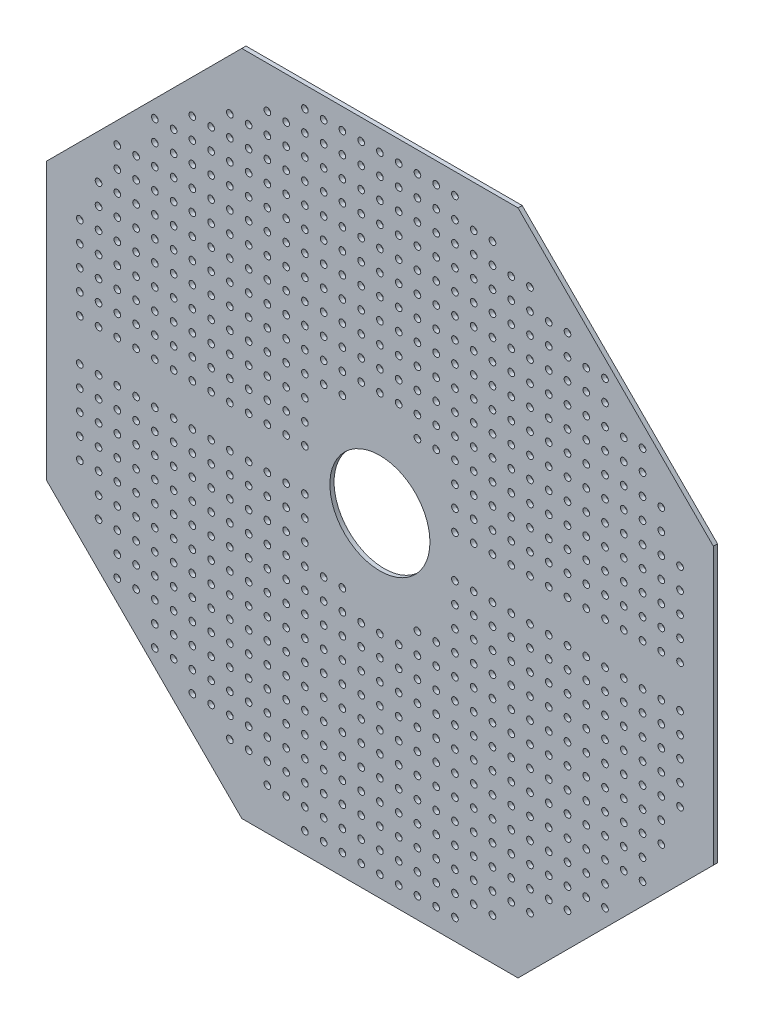
from build123d import *

# Parameters (mm, degrees)
SKETCH_1_R      = 120
SKETCH_1_R_2    = 8
EXTRUDE_1_DEPTH = 10


with BuildPart() as part:
    # 草图1 → 凸台-拉伸1 (new body)
    with BuildSketch(Plane.XY):
        Polygon((331.370849898, 800), (-331.370849898, 800), (-800, 331.370849898), (-800, -331.370849898), (-331.370849898, -800), (331.370849898, -800), (800, -331.370849898), (800, 331.370849898), align=None)
        Circle(SKETCH_1_R, mode=Mode.SUBTRACT)
        with Locations((180, 50)):
            Circle(SKETCH_1_R_2, mode=Mode.SUBTRACT)
        with Locations((225, 50)):
            Circle(SKETCH_1_R_2, mode=Mode.SUBTRACT)
        with Locations((270, 50)):
            Circle(SKETCH_1_R_2, mode=Mode.SUBTRACT)
        with Locations((315, 50)):
            Circle(SKETCH_1_R_2, mode=Mode.SUBTRACT)
        with Locations((360, 50)):
            Circle(SKETCH_1_R_2, mode=Mode.SUBTRACT)
        with Locations((405, 50)):
            Circle(SKETCH_1_R_2, mode=Mode.SUBTRACT)
        with Locations((450, 50)):
            Circle(SKETCH_1_R_2, mode=Mode.SUBTRACT)
        with Locations((495, 50)):
            Circle(SKETCH_1_R_2, mode=Mode.SUBTRACT)
        with Locations((540, 50)):
            Circle(SKETCH_1_R_2, mode=Mode.SUBTRACT)
        with Locations((585, 50)):
            Circle(SKETCH_1_R_2, mode=Mode.SUBTRACT)
        with Locations((630, 50)):
            Circle(SKETCH_1_R_2, mode=Mode.SUBTRACT)
        with Locations((675, 50)):
            Circle(SKETCH_1_R_2, mode=Mode.SUBTRACT)
        with Locations((720, 50)):
            Circle(SKETCH_1_R_2, mode=Mode.SUBTRACT)
        with Locations((180, 100)):
            Circle(SKETCH_1_R_2, mode=Mode.SUBTRACT)
        with Locations((225, 100)):
            Circle(SKETCH_1_R_2, mode=Mode.SUBTRACT)
        with Locations((270, 100)):
            Circle(SKETCH_1_R_2, mode=Mode.SUBTRACT)
        with Locations((315, 100)):
            Circle(SKETCH_1_R_2, mode=Mode.SUBTRACT)
        with Locations((360, 100)):
            Circle(SKETCH_1_R_2, mode=Mode.SUBTRACT)
        with Locations((405, 100)):
            Circle(SKETCH_1_R_2, mode=Mode.SUBTRACT)
        with Locations((450, 100)):
            Circle(SKETCH_1_R_2, mode=Mode.SUBTRACT)
        with Locations((495, 100)):
            Circle(SKETCH_1_R_2, mode=Mode.SUBTRACT)
        with Locations((540, 100)):
            Circle(SKETCH_1_R_2, mode=Mode.SUBTRACT)
        with Locations((585, 100)):
            Circle(SKETCH_1_R_2, mode=Mode.SUBTRACT)
        with Locations((630, 100)):
            Circle(SKETCH_1_R_2, mode=Mode.SUBTRACT)
        with Locations((675, 100)):
            Circle(SKETCH_1_R_2, mode=Mode.SUBTRACT)
        with Locations((720, 100)):
            Circle(SKETCH_1_R_2, mode=Mode.SUBTRACT)
        with Locations((180, 150)):
            Circle(SKETCH_1_R_2, mode=Mode.SUBTRACT)
        with Locations((225, 150)):
            Circle(SKETCH_1_R_2, mode=Mode.SUBTRACT)
        with Locations((270, 150)):
            Circle(SKETCH_1_R_2, mode=Mode.SUBTRACT)
        with Locations((315, 150)):
            Circle(SKETCH_1_R_2, mode=Mode.SUBTRACT)
        with Locations((360, 150)):
            Circle(SKETCH_1_R_2, mode=Mode.SUBTRACT)
        with Locations((405, 150)):
            Circle(SKETCH_1_R_2, mode=Mode.SUBTRACT)
        with Locations((450, 150)):
            Circle(SKETCH_1_R_2, mode=Mode.SUBTRACT)
        with Locations((495, 150)):
            Circle(SKETCH_1_R_2, mode=Mode.SUBTRACT)
        with Locations((540, 150)):
            Circle(SKETCH_1_R_2, mode=Mode.SUBTRACT)
        with Locations((585, 150)):
            Circle(SKETCH_1_R_2, mode=Mode.SUBTRACT)
        with Locations((630, 150)):
            Circle(SKETCH_1_R_2, mode=Mode.SUBTRACT)
        with Locations((675, 150)):
            Circle(SKETCH_1_R_2, mode=Mode.SUBTRACT)
        with Locations((720, 150)):
            Circle(SKETCH_1_R_2, mode=Mode.SUBTRACT)
        with Locations((90, 200)):
            Circle(SKETCH_1_R_2, mode=Mode.SUBTRACT)
        with Locations((135, 200)):
            Circle(SKETCH_1_R_2, mode=Mode.SUBTRACT)
        with Locations((180, 200)):
            Circle(SKETCH_1_R_2, mode=Mode.SUBTRACT)
        with Locations((225, 200)):
            Circle(SKETCH_1_R_2, mode=Mode.SUBTRACT)
        with Locations((270, 200)):
            Circle(SKETCH_1_R_2, mode=Mode.SUBTRACT)
        with Locations((315, 200)):
            Circle(SKETCH_1_R_2, mode=Mode.SUBTRACT)
        with Locations((360, 200)):
            Circle(SKETCH_1_R_2, mode=Mode.SUBTRACT)
        with Locations((405, 200)):
            Circle(SKETCH_1_R_2, mode=Mode.SUBTRACT)
        with Locations((450, 200)):
            Circle(SKETCH_1_R_2, mode=Mode.SUBTRACT)
        with Locations((495, 200)):
            Circle(SKETCH_1_R_2, mode=Mode.SUBTRACT)
        with Locations((540, 200)):
            Circle(SKETCH_1_R_2, mode=Mode.SUBTRACT)
        with Locations((585, 200)):
            Circle(SKETCH_1_R_2, mode=Mode.SUBTRACT)
        with Locations((630, 200)):
            Circle(SKETCH_1_R_2, mode=Mode.SUBTRACT)
        with Locations((675, 200)):
            Circle(SKETCH_1_R_2, mode=Mode.SUBTRACT)
        with Locations((720, 200)):
            Circle(SKETCH_1_R_2, mode=Mode.SUBTRACT)
        with Locations((0, 250)):
            Circle(SKETCH_1_R_2, mode=Mode.SUBTRACT)
        with Locations((45, 250)):
            Circle(SKETCH_1_R_2, mode=Mode.SUBTRACT)
        with Locations((90, 250)):
            Circle(SKETCH_1_R_2, mode=Mode.SUBTRACT)
        with Locations((135, 250)):
            Circle(SKETCH_1_R_2, mode=Mode.SUBTRACT)
        with Locations((180, 250)):
            Circle(SKETCH_1_R_2, mode=Mode.SUBTRACT)
        with Locations((225, 250)):
            Circle(SKETCH_1_R_2, mode=Mode.SUBTRACT)
        with Locations((270, 250)):
            Circle(SKETCH_1_R_2, mode=Mode.SUBTRACT)
        with Locations((315, 250)):
            Circle(SKETCH_1_R_2, mode=Mode.SUBTRACT)
        with Locations((360, 250)):
            Circle(SKETCH_1_R_2, mode=Mode.SUBTRACT)
        with Locations((405, 250)):
            Circle(SKETCH_1_R_2, mode=Mode.SUBTRACT)
        with Locations((450, 250)):
            Circle(SKETCH_1_R_2, mode=Mode.SUBTRACT)
        with Locations((495, 250)):
            Circle(SKETCH_1_R_2, mode=Mode.SUBTRACT)
        with Locations((540, 250)):
            Circle(SKETCH_1_R_2, mode=Mode.SUBTRACT)
        with Locations((585, 250)):
            Circle(SKETCH_1_R_2, mode=Mode.SUBTRACT)
        with Locations((630, 250)):
            Circle(SKETCH_1_R_2, mode=Mode.SUBTRACT)
        with Locations((675, 250)):
            Circle(SKETCH_1_R_2, mode=Mode.SUBTRACT)
        with Locations((720, 250)):
            Circle(SKETCH_1_R_2, mode=Mode.SUBTRACT)
        with Locations((0, 300)):
            Circle(SKETCH_1_R_2, mode=Mode.SUBTRACT)
        with Locations((45, 300)):
            Circle(SKETCH_1_R_2, mode=Mode.SUBTRACT)
        with Locations((90, 300)):
            Circle(SKETCH_1_R_2, mode=Mode.SUBTRACT)
        with Locations((135, 300)):
            Circle(SKETCH_1_R_2, mode=Mode.SUBTRACT)
        with Locations((180, 300)):
            Circle(SKETCH_1_R_2, mode=Mode.SUBTRACT)
        with Locations((225, 300)):
            Circle(SKETCH_1_R_2, mode=Mode.SUBTRACT)
        with Locations((270, 300)):
            Circle(SKETCH_1_R_2, mode=Mode.SUBTRACT)
        with Locations((315, 300)):
            Circle(SKETCH_1_R_2, mode=Mode.SUBTRACT)
        with Locations((360, 300)):
            Circle(SKETCH_1_R_2, mode=Mode.SUBTRACT)
        with Locations((405, 300)):
            Circle(SKETCH_1_R_2, mode=Mode.SUBTRACT)
        with Locations((450, 300)):
            Circle(SKETCH_1_R_2, mode=Mode.SUBTRACT)
        with Locations((495, 300)):
            Circle(SKETCH_1_R_2, mode=Mode.SUBTRACT)
        with Locations((540, 300)):
            Circle(SKETCH_1_R_2, mode=Mode.SUBTRACT)
        with Locations((585, 300)):
            Circle(SKETCH_1_R_2, mode=Mode.SUBTRACT)
        with Locations((630, 300)):
            Circle(SKETCH_1_R_2, mode=Mode.SUBTRACT)
        with Locations((675, 300)):
            Circle(SKETCH_1_R_2, mode=Mode.SUBTRACT)
        with Locations((0, 350)):
            Circle(SKETCH_1_R_2, mode=Mode.SUBTRACT)
        with Locations((45, 350)):
            Circle(SKETCH_1_R_2, mode=Mode.SUBTRACT)
        with Locations((90, 350)):
            Circle(SKETCH_1_R_2, mode=Mode.SUBTRACT)
        with Locations((135, 350)):
            Circle(SKETCH_1_R_2, mode=Mode.SUBTRACT)
        with Locations((180, 350)):
            Circle(SKETCH_1_R_2, mode=Mode.SUBTRACT)
        with Locations((225, 350)):
            Circle(SKETCH_1_R_2, mode=Mode.SUBTRACT)
        with Locations((270, 350)):
            Circle(SKETCH_1_R_2, mode=Mode.SUBTRACT)
        with Locations((315, 350)):
            Circle(SKETCH_1_R_2, mode=Mode.SUBTRACT)
        with Locations((360, 350)):
            Circle(SKETCH_1_R_2, mode=Mode.SUBTRACT)
        with Locations((405, 350)):
            Circle(SKETCH_1_R_2, mode=Mode.SUBTRACT)
        with Locations((450, 350)):
            Circle(SKETCH_1_R_2, mode=Mode.SUBTRACT)
        with Locations((495, 350)):
            Circle(SKETCH_1_R_2, mode=Mode.SUBTRACT)
        with Locations((540, 350)):
            Circle(SKETCH_1_R_2, mode=Mode.SUBTRACT)
        with Locations((585, 350)):
            Circle(SKETCH_1_R_2, mode=Mode.SUBTRACT)
        with Locations((630, 350)):
            Circle(SKETCH_1_R_2, mode=Mode.SUBTRACT)
        with Locations((675, 350)):
            Circle(SKETCH_1_R_2, mode=Mode.SUBTRACT)
        with Locations((0, 400)):
            Circle(SKETCH_1_R_2, mode=Mode.SUBTRACT)
        with Locations((45, 400)):
            Circle(SKETCH_1_R_2, mode=Mode.SUBTRACT)
        with Locations((90, 400)):
            Circle(SKETCH_1_R_2, mode=Mode.SUBTRACT)
        with Locations((135, 400)):
            Circle(SKETCH_1_R_2, mode=Mode.SUBTRACT)
        with Locations((180, 400)):
            Circle(SKETCH_1_R_2, mode=Mode.SUBTRACT)
        with Locations((225, 400)):
            Circle(SKETCH_1_R_2, mode=Mode.SUBTRACT)
        with Locations((270, 400)):
            Circle(SKETCH_1_R_2, mode=Mode.SUBTRACT)
        with Locations((315, 400)):
            Circle(SKETCH_1_R_2, mode=Mode.SUBTRACT)
        with Locations((360, 400)):
            Circle(SKETCH_1_R_2, mode=Mode.SUBTRACT)
        with Locations((405, 400)):
            Circle(SKETCH_1_R_2, mode=Mode.SUBTRACT)
        with Locations((450, 400)):
            Circle(SKETCH_1_R_2, mode=Mode.SUBTRACT)
        with Locations((495, 400)):
            Circle(SKETCH_1_R_2, mode=Mode.SUBTRACT)
        with Locations((540, 400)):
            Circle(SKETCH_1_R_2, mode=Mode.SUBTRACT)
        with Locations((585, 400)):
            Circle(SKETCH_1_R_2, mode=Mode.SUBTRACT)
        with Locations((630, 400)):
            Circle(SKETCH_1_R_2, mode=Mode.SUBTRACT)
        with Locations((0, 450)):
            Circle(SKETCH_1_R_2, mode=Mode.SUBTRACT)
        with Locations((45, 450)):
            Circle(SKETCH_1_R_2, mode=Mode.SUBTRACT)
        with Locations((90, 450)):
            Circle(SKETCH_1_R_2, mode=Mode.SUBTRACT)
        with Locations((135, 450)):
            Circle(SKETCH_1_R_2, mode=Mode.SUBTRACT)
        with Locations((180, 450)):
            Circle(SKETCH_1_R_2, mode=Mode.SUBTRACT)
        with Locations((225, 450)):
            Circle(SKETCH_1_R_2, mode=Mode.SUBTRACT)
        with Locations((270, 450)):
            Circle(SKETCH_1_R_2, mode=Mode.SUBTRACT)
        with Locations((315, 450)):
            Circle(SKETCH_1_R_2, mode=Mode.SUBTRACT)
        with Locations((360, 450)):
            Circle(SKETCH_1_R_2, mode=Mode.SUBTRACT)
        with Locations((405, 450)):
            Circle(SKETCH_1_R_2, mode=Mode.SUBTRACT)
        with Locations((450, 450)):
            Circle(SKETCH_1_R_2, mode=Mode.SUBTRACT)
        with Locations((495, 450)):
            Circle(SKETCH_1_R_2, mode=Mode.SUBTRACT)
        with Locations((540, 450)):
            Circle(SKETCH_1_R_2, mode=Mode.SUBTRACT)
        with Locations((585, 450)):
            Circle(SKETCH_1_R_2, mode=Mode.SUBTRACT)
        with Locations((630, 450)):
            Circle(SKETCH_1_R_2, mode=Mode.SUBTRACT)
        with Locations((0, 500)):
            Circle(SKETCH_1_R_2, mode=Mode.SUBTRACT)
        with Locations((45, 500)):
            Circle(SKETCH_1_R_2, mode=Mode.SUBTRACT)
        with Locations((90, 500)):
            Circle(SKETCH_1_R_2, mode=Mode.SUBTRACT)
        with Locations((135, 500)):
            Circle(SKETCH_1_R_2, mode=Mode.SUBTRACT)
        with Locations((180, 500)):
            Circle(SKETCH_1_R_2, mode=Mode.SUBTRACT)
        with Locations((225, 500)):
            Circle(SKETCH_1_R_2, mode=Mode.SUBTRACT)
        with Locations((270, 500)):
            Circle(SKETCH_1_R_2, mode=Mode.SUBTRACT)
        with Locations((315, 500)):
            Circle(SKETCH_1_R_2, mode=Mode.SUBTRACT)
        with Locations((360, 500)):
            Circle(SKETCH_1_R_2, mode=Mode.SUBTRACT)
        with Locations((405, 500)):
            Circle(SKETCH_1_R_2, mode=Mode.SUBTRACT)
        with Locations((450, 500)):
            Circle(SKETCH_1_R_2, mode=Mode.SUBTRACT)
        with Locations((495, 500)):
            Circle(SKETCH_1_R_2, mode=Mode.SUBTRACT)
        with Locations((540, 500)):
            Circle(SKETCH_1_R_2, mode=Mode.SUBTRACT)
        with Locations((0, 550)):
            Circle(SKETCH_1_R_2, mode=Mode.SUBTRACT)
        with Locations((45, 550)):
            Circle(SKETCH_1_R_2, mode=Mode.SUBTRACT)
        with Locations((90, 550)):
            Circle(SKETCH_1_R_2, mode=Mode.SUBTRACT)
        with Locations((135, 550)):
            Circle(SKETCH_1_R_2, mode=Mode.SUBTRACT)
        with Locations((180, 550)):
            Circle(SKETCH_1_R_2, mode=Mode.SUBTRACT)
        with Locations((225, 550)):
            Circle(SKETCH_1_R_2, mode=Mode.SUBTRACT)
        with Locations((270, 550)):
            Circle(SKETCH_1_R_2, mode=Mode.SUBTRACT)
        with Locations((315, 550)):
            Circle(SKETCH_1_R_2, mode=Mode.SUBTRACT)
        with Locations((360, 550)):
            Circle(SKETCH_1_R_2, mode=Mode.SUBTRACT)
        with Locations((405, 550)):
            Circle(SKETCH_1_R_2, mode=Mode.SUBTRACT)
        with Locations((450, 550)):
            Circle(SKETCH_1_R_2, mode=Mode.SUBTRACT)
        with Locations((495, 550)):
            Circle(SKETCH_1_R_2, mode=Mode.SUBTRACT)
        with Locations((540, 550)):
            Circle(SKETCH_1_R_2, mode=Mode.SUBTRACT)
        with Locations((0, 600)):
            Circle(SKETCH_1_R_2, mode=Mode.SUBTRACT)
        with Locations((45, 600)):
            Circle(SKETCH_1_R_2, mode=Mode.SUBTRACT)
        with Locations((90, 600)):
            Circle(SKETCH_1_R_2, mode=Mode.SUBTRACT)
        with Locations((135, 600)):
            Circle(SKETCH_1_R_2, mode=Mode.SUBTRACT)
        with Locations((180, 600)):
            Circle(SKETCH_1_R_2, mode=Mode.SUBTRACT)
        with Locations((225, 600)):
            Circle(SKETCH_1_R_2, mode=Mode.SUBTRACT)
        with Locations((270, 600)):
            Circle(SKETCH_1_R_2, mode=Mode.SUBTRACT)
        with Locations((315, 600)):
            Circle(SKETCH_1_R_2, mode=Mode.SUBTRACT)
        with Locations((360, 600)):
            Circle(SKETCH_1_R_2, mode=Mode.SUBTRACT)
        with Locations((405, 600)):
            Circle(SKETCH_1_R_2, mode=Mode.SUBTRACT)
        with Locations((450, 600)):
            Circle(SKETCH_1_R_2, mode=Mode.SUBTRACT)
        with Locations((0, 650)):
            Circle(SKETCH_1_R_2, mode=Mode.SUBTRACT)
        with Locations((45, 650)):
            Circle(SKETCH_1_R_2, mode=Mode.SUBTRACT)
        with Locations((90, 650)):
            Circle(SKETCH_1_R_2, mode=Mode.SUBTRACT)
        with Locations((135, 650)):
            Circle(SKETCH_1_R_2, mode=Mode.SUBTRACT)
        with Locations((180, 650)):
            Circle(SKETCH_1_R_2, mode=Mode.SUBTRACT)
        with Locations((225, 650)):
            Circle(SKETCH_1_R_2, mode=Mode.SUBTRACT)
        with Locations((270, 650)):
            Circle(SKETCH_1_R_2, mode=Mode.SUBTRACT)
        with Locations((315, 650)):
            Circle(SKETCH_1_R_2, mode=Mode.SUBTRACT)
        with Locations((360, 650)):
            Circle(SKETCH_1_R_2, mode=Mode.SUBTRACT)
        with Locations((0, 700)):
            Circle(SKETCH_1_R_2, mode=Mode.SUBTRACT)
        with Locations((45, 700)):
            Circle(SKETCH_1_R_2, mode=Mode.SUBTRACT)
        with Locations((90, 700)):
            Circle(SKETCH_1_R_2, mode=Mode.SUBTRACT)
        with Locations((135, 700)):
            Circle(SKETCH_1_R_2, mode=Mode.SUBTRACT)
        with Locations((180, 700)):
            Circle(SKETCH_1_R_2, mode=Mode.SUBTRACT)
        with Locations((225, 700)):
            Circle(SKETCH_1_R_2, mode=Mode.SUBTRACT)
        with Locations((270, 700)):
            Circle(SKETCH_1_R_2, mode=Mode.SUBTRACT)
        with Locations((0, 750)):
            Circle(SKETCH_1_R_2, mode=Mode.SUBTRACT)
        with Locations((45, 750)):
            Circle(SKETCH_1_R_2, mode=Mode.SUBTRACT)
        with Locations((90, 750)):
            Circle(SKETCH_1_R_2, mode=Mode.SUBTRACT)
        with Locations((135, 750)):
            Circle(SKETCH_1_R_2, mode=Mode.SUBTRACT)
        with Locations((180, 750)):
            Circle(SKETCH_1_R_2, mode=Mode.SUBTRACT)
        with Locations((-180, 750)):
            Circle(SKETCH_1_R_2, mode=Mode.SUBTRACT)
        with Locations((-135, 750)):
            Circle(SKETCH_1_R_2, mode=Mode.SUBTRACT)
        with Locations((-90, 750)):
            Circle(SKETCH_1_R_2, mode=Mode.SUBTRACT)
        with Locations((-45, 750)):
            Circle(SKETCH_1_R_2, mode=Mode.SUBTRACT)
        with Locations((-270, 700)):
            Circle(SKETCH_1_R_2, mode=Mode.SUBTRACT)
        with Locations((-225, 700)):
            Circle(SKETCH_1_R_2, mode=Mode.SUBTRACT)
        with Locations((-180, 700)):
            Circle(SKETCH_1_R_2, mode=Mode.SUBTRACT)
        with Locations((-135, 700)):
            Circle(SKETCH_1_R_2, mode=Mode.SUBTRACT)
        with Locations((-90, 700)):
            Circle(SKETCH_1_R_2, mode=Mode.SUBTRACT)
        with Locations((-45, 700)):
            Circle(SKETCH_1_R_2, mode=Mode.SUBTRACT)
        with Locations((-360, 650)):
            Circle(SKETCH_1_R_2, mode=Mode.SUBTRACT)
        with Locations((-315, 650)):
            Circle(SKETCH_1_R_2, mode=Mode.SUBTRACT)
        with Locations((-270, 650)):
            Circle(SKETCH_1_R_2, mode=Mode.SUBTRACT)
        with Locations((-225, 650)):
            Circle(SKETCH_1_R_2, mode=Mode.SUBTRACT)
        with Locations((-180, 650)):
            Circle(SKETCH_1_R_2, mode=Mode.SUBTRACT)
        with Locations((-135, 650)):
            Circle(SKETCH_1_R_2, mode=Mode.SUBTRACT)
        with Locations((-90, 650)):
            Circle(SKETCH_1_R_2, mode=Mode.SUBTRACT)
        with Locations((-45, 650)):
            Circle(SKETCH_1_R_2, mode=Mode.SUBTRACT)
        with Locations((-450, 600)):
            Circle(SKETCH_1_R_2, mode=Mode.SUBTRACT)
        with Locations((-405, 600)):
            Circle(SKETCH_1_R_2, mode=Mode.SUBTRACT)
        with Locations((-360, 600)):
            Circle(SKETCH_1_R_2, mode=Mode.SUBTRACT)
        with Locations((-315, 600)):
            Circle(SKETCH_1_R_2, mode=Mode.SUBTRACT)
        with Locations((-270, 600)):
            Circle(SKETCH_1_R_2, mode=Mode.SUBTRACT)
        with Locations((-225, 600)):
            Circle(SKETCH_1_R_2, mode=Mode.SUBTRACT)
        with Locations((-180, 600)):
            Circle(SKETCH_1_R_2, mode=Mode.SUBTRACT)
        with Locations((-135, 600)):
            Circle(SKETCH_1_R_2, mode=Mode.SUBTRACT)
        with Locations((-90, 600)):
            Circle(SKETCH_1_R_2, mode=Mode.SUBTRACT)
        with Locations((-45, 600)):
            Circle(SKETCH_1_R_2, mode=Mode.SUBTRACT)
        with Locations((-540, 550)):
            Circle(SKETCH_1_R_2, mode=Mode.SUBTRACT)
        with Locations((-495, 550)):
            Circle(SKETCH_1_R_2, mode=Mode.SUBTRACT)
        with Locations((-450, 550)):
            Circle(SKETCH_1_R_2, mode=Mode.SUBTRACT)
        with Locations((-405, 550)):
            Circle(SKETCH_1_R_2, mode=Mode.SUBTRACT)
        with Locations((-360, 550)):
            Circle(SKETCH_1_R_2, mode=Mode.SUBTRACT)
        with Locations((-315, 550)):
            Circle(SKETCH_1_R_2, mode=Mode.SUBTRACT)
        with Locations((-270, 550)):
            Circle(SKETCH_1_R_2, mode=Mode.SUBTRACT)
        with Locations((-225, 550)):
            Circle(SKETCH_1_R_2, mode=Mode.SUBTRACT)
        with Locations((-180, 550)):
            Circle(SKETCH_1_R_2, mode=Mode.SUBTRACT)
        with Locations((-135, 550)):
            Circle(SKETCH_1_R_2, mode=Mode.SUBTRACT)
        with Locations((-90, 550)):
            Circle(SKETCH_1_R_2, mode=Mode.SUBTRACT)
        with Locations((-45, 550)):
            Circle(SKETCH_1_R_2, mode=Mode.SUBTRACT)
        with Locations((-540, 500)):
            Circle(SKETCH_1_R_2, mode=Mode.SUBTRACT)
        with Locations((-495, 500)):
            Circle(SKETCH_1_R_2, mode=Mode.SUBTRACT)
        with Locations((-450, 500)):
            Circle(SKETCH_1_R_2, mode=Mode.SUBTRACT)
        with Locations((-405, 500)):
            Circle(SKETCH_1_R_2, mode=Mode.SUBTRACT)
        with Locations((-360, 500)):
            Circle(SKETCH_1_R_2, mode=Mode.SUBTRACT)
        with Locations((-315, 500)):
            Circle(SKETCH_1_R_2, mode=Mode.SUBTRACT)
        with Locations((-270, 500)):
            Circle(SKETCH_1_R_2, mode=Mode.SUBTRACT)
        with Locations((-225, 500)):
            Circle(SKETCH_1_R_2, mode=Mode.SUBTRACT)
        with Locations((-180, 500)):
            Circle(SKETCH_1_R_2, mode=Mode.SUBTRACT)
        with Locations((-135, 500)):
            Circle(SKETCH_1_R_2, mode=Mode.SUBTRACT)
        with Locations((-90, 500)):
            Circle(SKETCH_1_R_2, mode=Mode.SUBTRACT)
        with Locations((-45, 500)):
            Circle(SKETCH_1_R_2, mode=Mode.SUBTRACT)
        with Locations((-630, 450)):
            Circle(SKETCH_1_R_2, mode=Mode.SUBTRACT)
        with Locations((-585, 450)):
            Circle(SKETCH_1_R_2, mode=Mode.SUBTRACT)
        with Locations((-540, 450)):
            Circle(SKETCH_1_R_2, mode=Mode.SUBTRACT)
        with Locations((-495, 450)):
            Circle(SKETCH_1_R_2, mode=Mode.SUBTRACT)
        with Locations((-450, 450)):
            Circle(SKETCH_1_R_2, mode=Mode.SUBTRACT)
        with Locations((-405, 450)):
            Circle(SKETCH_1_R_2, mode=Mode.SUBTRACT)
        with Locations((-360, 450)):
            Circle(SKETCH_1_R_2, mode=Mode.SUBTRACT)
        with Locations((-315, 450)):
            Circle(SKETCH_1_R_2, mode=Mode.SUBTRACT)
        with Locations((-270, 450)):
            Circle(SKETCH_1_R_2, mode=Mode.SUBTRACT)
        with Locations((-225, 450)):
            Circle(SKETCH_1_R_2, mode=Mode.SUBTRACT)
        with Locations((-180, 450)):
            Circle(SKETCH_1_R_2, mode=Mode.SUBTRACT)
        with Locations((-135, 450)):
            Circle(SKETCH_1_R_2, mode=Mode.SUBTRACT)
        with Locations((-90, 450)):
            Circle(SKETCH_1_R_2, mode=Mode.SUBTRACT)
        with Locations((-45, 450)):
            Circle(SKETCH_1_R_2, mode=Mode.SUBTRACT)
        with Locations((-630, 400)):
            Circle(SKETCH_1_R_2, mode=Mode.SUBTRACT)
        with Locations((-585, 400)):
            Circle(SKETCH_1_R_2, mode=Mode.SUBTRACT)
        with Locations((-540, 400)):
            Circle(SKETCH_1_R_2, mode=Mode.SUBTRACT)
        with Locations((-495, 400)):
            Circle(SKETCH_1_R_2, mode=Mode.SUBTRACT)
        with Locations((-450, 400)):
            Circle(SKETCH_1_R_2, mode=Mode.SUBTRACT)
        with Locations((-405, 400)):
            Circle(SKETCH_1_R_2, mode=Mode.SUBTRACT)
        with Locations((-360, 400)):
            Circle(SKETCH_1_R_2, mode=Mode.SUBTRACT)
        with Locations((-315, 400)):
            Circle(SKETCH_1_R_2, mode=Mode.SUBTRACT)
        with Locations((-270, 400)):
            Circle(SKETCH_1_R_2, mode=Mode.SUBTRACT)
        with Locations((-225, 400)):
            Circle(SKETCH_1_R_2, mode=Mode.SUBTRACT)
        with Locations((-180, 400)):
            Circle(SKETCH_1_R_2, mode=Mode.SUBTRACT)
        with Locations((-135, 400)):
            Circle(SKETCH_1_R_2, mode=Mode.SUBTRACT)
        with Locations((-90, 400)):
            Circle(SKETCH_1_R_2, mode=Mode.SUBTRACT)
        with Locations((-45, 400)):
            Circle(SKETCH_1_R_2, mode=Mode.SUBTRACT)
        with Locations((-675, 350)):
            Circle(SKETCH_1_R_2, mode=Mode.SUBTRACT)
        with Locations((-630, 350)):
            Circle(SKETCH_1_R_2, mode=Mode.SUBTRACT)
        with Locations((-585, 350)):
            Circle(SKETCH_1_R_2, mode=Mode.SUBTRACT)
        with Locations((-540, 350)):
            Circle(SKETCH_1_R_2, mode=Mode.SUBTRACT)
        with Locations((-495, 350)):
            Circle(SKETCH_1_R_2, mode=Mode.SUBTRACT)
        with Locations((-450, 350)):
            Circle(SKETCH_1_R_2, mode=Mode.SUBTRACT)
        with Locations((-405, 350)):
            Circle(SKETCH_1_R_2, mode=Mode.SUBTRACT)
        with Locations((-360, 350)):
            Circle(SKETCH_1_R_2, mode=Mode.SUBTRACT)
        with Locations((-315, 350)):
            Circle(SKETCH_1_R_2, mode=Mode.SUBTRACT)
        with Locations((-270, 350)):
            Circle(SKETCH_1_R_2, mode=Mode.SUBTRACT)
        with Locations((-225, 350)):
            Circle(SKETCH_1_R_2, mode=Mode.SUBTRACT)
        with Locations((-180, 350)):
            Circle(SKETCH_1_R_2, mode=Mode.SUBTRACT)
        with Locations((-135, 350)):
            Circle(SKETCH_1_R_2, mode=Mode.SUBTRACT)
        with Locations((-90, 350)):
            Circle(SKETCH_1_R_2, mode=Mode.SUBTRACT)
        with Locations((-45, 350)):
            Circle(SKETCH_1_R_2, mode=Mode.SUBTRACT)
        with Locations((-675, 300)):
            Circle(SKETCH_1_R_2, mode=Mode.SUBTRACT)
        with Locations((-630, 300)):
            Circle(SKETCH_1_R_2, mode=Mode.SUBTRACT)
        with Locations((-585, 300)):
            Circle(SKETCH_1_R_2, mode=Mode.SUBTRACT)
        with Locations((-540, 300)):
            Circle(SKETCH_1_R_2, mode=Mode.SUBTRACT)
        with Locations((-495, 300)):
            Circle(SKETCH_1_R_2, mode=Mode.SUBTRACT)
        with Locations((-450, 300)):
            Circle(SKETCH_1_R_2, mode=Mode.SUBTRACT)
        with Locations((-405, 300)):
            Circle(SKETCH_1_R_2, mode=Mode.SUBTRACT)
        with Locations((-360, 300)):
            Circle(SKETCH_1_R_2, mode=Mode.SUBTRACT)
        with Locations((-315, 300)):
            Circle(SKETCH_1_R_2, mode=Mode.SUBTRACT)
        with Locations((-270, 300)):
            Circle(SKETCH_1_R_2, mode=Mode.SUBTRACT)
        with Locations((-225, 300)):
            Circle(SKETCH_1_R_2, mode=Mode.SUBTRACT)
        with Locations((-180, 300)):
            Circle(SKETCH_1_R_2, mode=Mode.SUBTRACT)
        with Locations((-135, 300)):
            Circle(SKETCH_1_R_2, mode=Mode.SUBTRACT)
        with Locations((-90, 300)):
            Circle(SKETCH_1_R_2, mode=Mode.SUBTRACT)
        with Locations((-45, 300)):
            Circle(SKETCH_1_R_2, mode=Mode.SUBTRACT)
        with Locations((-720, 250)):
            Circle(SKETCH_1_R_2, mode=Mode.SUBTRACT)
        with Locations((-675, 250)):
            Circle(SKETCH_1_R_2, mode=Mode.SUBTRACT)
        with Locations((-630, 250)):
            Circle(SKETCH_1_R_2, mode=Mode.SUBTRACT)
        with Locations((-585, 250)):
            Circle(SKETCH_1_R_2, mode=Mode.SUBTRACT)
        with Locations((-540, 250)):
            Circle(SKETCH_1_R_2, mode=Mode.SUBTRACT)
        with Locations((-495, 250)):
            Circle(SKETCH_1_R_2, mode=Mode.SUBTRACT)
        with Locations((-450, 250)):
            Circle(SKETCH_1_R_2, mode=Mode.SUBTRACT)
        with Locations((-405, 250)):
            Circle(SKETCH_1_R_2, mode=Mode.SUBTRACT)
        with Locations((-360, 250)):
            Circle(SKETCH_1_R_2, mode=Mode.SUBTRACT)
        with Locations((-315, 250)):
            Circle(SKETCH_1_R_2, mode=Mode.SUBTRACT)
        with Locations((-270, 250)):
            Circle(SKETCH_1_R_2, mode=Mode.SUBTRACT)
        with Locations((-225, 250)):
            Circle(SKETCH_1_R_2, mode=Mode.SUBTRACT)
        with Locations((-180, 250)):
            Circle(SKETCH_1_R_2, mode=Mode.SUBTRACT)
        with Locations((-135, 250)):
            Circle(SKETCH_1_R_2, mode=Mode.SUBTRACT)
        with Locations((-90, 250)):
            Circle(SKETCH_1_R_2, mode=Mode.SUBTRACT)
        with Locations((-45, 250)):
            Circle(SKETCH_1_R_2, mode=Mode.SUBTRACT)
        with Locations((-720, 200)):
            Circle(SKETCH_1_R_2, mode=Mode.SUBTRACT)
        with Locations((-675, 200)):
            Circle(SKETCH_1_R_2, mode=Mode.SUBTRACT)
        with Locations((-630, 200)):
            Circle(SKETCH_1_R_2, mode=Mode.SUBTRACT)
        with Locations((-585, 200)):
            Circle(SKETCH_1_R_2, mode=Mode.SUBTRACT)
        with Locations((-540, 200)):
            Circle(SKETCH_1_R_2, mode=Mode.SUBTRACT)
        with Locations((-495, 200)):
            Circle(SKETCH_1_R_2, mode=Mode.SUBTRACT)
        with Locations((-450, 200)):
            Circle(SKETCH_1_R_2, mode=Mode.SUBTRACT)
        with Locations((-405, 200)):
            Circle(SKETCH_1_R_2, mode=Mode.SUBTRACT)
        with Locations((-360, 200)):
            Circle(SKETCH_1_R_2, mode=Mode.SUBTRACT)
        with Locations((-315, 200)):
            Circle(SKETCH_1_R_2, mode=Mode.SUBTRACT)
        with Locations((-270, 200)):
            Circle(SKETCH_1_R_2, mode=Mode.SUBTRACT)
        with Locations((-225, 200)):
            Circle(SKETCH_1_R_2, mode=Mode.SUBTRACT)
        with Locations((-180, 200)):
            Circle(SKETCH_1_R_2, mode=Mode.SUBTRACT)
        with Locations((-135, 200)):
            Circle(SKETCH_1_R_2, mode=Mode.SUBTRACT)
        with Locations((-90, 200)):
            Circle(SKETCH_1_R_2, mode=Mode.SUBTRACT)
        with Locations((-720, 150)):
            Circle(SKETCH_1_R_2, mode=Mode.SUBTRACT)
        with Locations((-675, 150)):
            Circle(SKETCH_1_R_2, mode=Mode.SUBTRACT)
        with Locations((-630, 150)):
            Circle(SKETCH_1_R_2, mode=Mode.SUBTRACT)
        with Locations((-585, 150)):
            Circle(SKETCH_1_R_2, mode=Mode.SUBTRACT)
        with Locations((-540, 150)):
            Circle(SKETCH_1_R_2, mode=Mode.SUBTRACT)
        with Locations((-495, 150)):
            Circle(SKETCH_1_R_2, mode=Mode.SUBTRACT)
        with Locations((-450, 150)):
            Circle(SKETCH_1_R_2, mode=Mode.SUBTRACT)
        with Locations((-405, 150)):
            Circle(SKETCH_1_R_2, mode=Mode.SUBTRACT)
        with Locations((-360, 150)):
            Circle(SKETCH_1_R_2, mode=Mode.SUBTRACT)
        with Locations((-315, 150)):
            Circle(SKETCH_1_R_2, mode=Mode.SUBTRACT)
        with Locations((-270, 150)):
            Circle(SKETCH_1_R_2, mode=Mode.SUBTRACT)
        with Locations((-225, 150)):
            Circle(SKETCH_1_R_2, mode=Mode.SUBTRACT)
        with Locations((-180, 150)):
            Circle(SKETCH_1_R_2, mode=Mode.SUBTRACT)
        with Locations((-720, 100)):
            Circle(SKETCH_1_R_2, mode=Mode.SUBTRACT)
        with Locations((-675, 100)):
            Circle(SKETCH_1_R_2, mode=Mode.SUBTRACT)
        with Locations((-630, 100)):
            Circle(SKETCH_1_R_2, mode=Mode.SUBTRACT)
        with Locations((-585, 100)):
            Circle(SKETCH_1_R_2, mode=Mode.SUBTRACT)
        with Locations((-540, 100)):
            Circle(SKETCH_1_R_2, mode=Mode.SUBTRACT)
        with Locations((-495, 100)):
            Circle(SKETCH_1_R_2, mode=Mode.SUBTRACT)
        with Locations((-450, 100)):
            Circle(SKETCH_1_R_2, mode=Mode.SUBTRACT)
        with Locations((-405, 100)):
            Circle(SKETCH_1_R_2, mode=Mode.SUBTRACT)
        with Locations((-360, 100)):
            Circle(SKETCH_1_R_2, mode=Mode.SUBTRACT)
        with Locations((-315, 100)):
            Circle(SKETCH_1_R_2, mode=Mode.SUBTRACT)
        with Locations((-270, 100)):
            Circle(SKETCH_1_R_2, mode=Mode.SUBTRACT)
        with Locations((-225, 100)):
            Circle(SKETCH_1_R_2, mode=Mode.SUBTRACT)
        with Locations((-180, 100)):
            Circle(SKETCH_1_R_2, mode=Mode.SUBTRACT)
        with Locations((-720, 50)):
            Circle(SKETCH_1_R_2, mode=Mode.SUBTRACT)
        with Locations((-675, 50)):
            Circle(SKETCH_1_R_2, mode=Mode.SUBTRACT)
        with Locations((-630, 50)):
            Circle(SKETCH_1_R_2, mode=Mode.SUBTRACT)
        with Locations((-585, 50)):
            Circle(SKETCH_1_R_2, mode=Mode.SUBTRACT)
        with Locations((-540, 50)):
            Circle(SKETCH_1_R_2, mode=Mode.SUBTRACT)
        with Locations((-495, 50)):
            Circle(SKETCH_1_R_2, mode=Mode.SUBTRACT)
        with Locations((-450, 50)):
            Circle(SKETCH_1_R_2, mode=Mode.SUBTRACT)
        with Locations((-405, 50)):
            Circle(SKETCH_1_R_2, mode=Mode.SUBTRACT)
        with Locations((-360, 50)):
            Circle(SKETCH_1_R_2, mode=Mode.SUBTRACT)
        with Locations((-315, 50)):
            Circle(SKETCH_1_R_2, mode=Mode.SUBTRACT)
        with Locations((-270, 50)):
            Circle(SKETCH_1_R_2, mode=Mode.SUBTRACT)
        with Locations((-225, 50)):
            Circle(SKETCH_1_R_2, mode=Mode.SUBTRACT)
        with Locations((-180, 50)):
            Circle(SKETCH_1_R_2, mode=Mode.SUBTRACT)
        with Locations((-180, -50)):
            Circle(SKETCH_1_R_2, mode=Mode.SUBTRACT)
        with Locations((-225, -50)):
            Circle(SKETCH_1_R_2, mode=Mode.SUBTRACT)
        with Locations((-270, -50)):
            Circle(SKETCH_1_R_2, mode=Mode.SUBTRACT)
        with Locations((-315, -50)):
            Circle(SKETCH_1_R_2, mode=Mode.SUBTRACT)
        with Locations((-360, -50)):
            Circle(SKETCH_1_R_2, mode=Mode.SUBTRACT)
        with Locations((-405, -50)):
            Circle(SKETCH_1_R_2, mode=Mode.SUBTRACT)
        with Locations((-450, -50)):
            Circle(SKETCH_1_R_2, mode=Mode.SUBTRACT)
        with Locations((-495, -50)):
            Circle(SKETCH_1_R_2, mode=Mode.SUBTRACT)
        with Locations((-540, -50)):
            Circle(SKETCH_1_R_2, mode=Mode.SUBTRACT)
        with Locations((-585, -50)):
            Circle(SKETCH_1_R_2, mode=Mode.SUBTRACT)
        with Locations((-630, -50)):
            Circle(SKETCH_1_R_2, mode=Mode.SUBTRACT)
        with Locations((-675, -50)):
            Circle(SKETCH_1_R_2, mode=Mode.SUBTRACT)
        with Locations((-720, -50)):
            Circle(SKETCH_1_R_2, mode=Mode.SUBTRACT)
        with Locations((-180, -100)):
            Circle(SKETCH_1_R_2, mode=Mode.SUBTRACT)
        with Locations((-225, -100)):
            Circle(SKETCH_1_R_2, mode=Mode.SUBTRACT)
        with Locations((-270, -100)):
            Circle(SKETCH_1_R_2, mode=Mode.SUBTRACT)
        with Locations((-315, -100)):
            Circle(SKETCH_1_R_2, mode=Mode.SUBTRACT)
        with Locations((-360, -100)):
            Circle(SKETCH_1_R_2, mode=Mode.SUBTRACT)
        with Locations((-405, -100)):
            Circle(SKETCH_1_R_2, mode=Mode.SUBTRACT)
        with Locations((-450, -100)):
            Circle(SKETCH_1_R_2, mode=Mode.SUBTRACT)
        with Locations((-495, -100)):
            Circle(SKETCH_1_R_2, mode=Mode.SUBTRACT)
        with Locations((-540, -100)):
            Circle(SKETCH_1_R_2, mode=Mode.SUBTRACT)
        with Locations((-585, -100)):
            Circle(SKETCH_1_R_2, mode=Mode.SUBTRACT)
        with Locations((-630, -100)):
            Circle(SKETCH_1_R_2, mode=Mode.SUBTRACT)
        with Locations((-675, -100)):
            Circle(SKETCH_1_R_2, mode=Mode.SUBTRACT)
        with Locations((-720, -100)):
            Circle(SKETCH_1_R_2, mode=Mode.SUBTRACT)
        with Locations((-180, -150)):
            Circle(SKETCH_1_R_2, mode=Mode.SUBTRACT)
        with Locations((-225, -150)):
            Circle(SKETCH_1_R_2, mode=Mode.SUBTRACT)
        with Locations((-270, -150)):
            Circle(SKETCH_1_R_2, mode=Mode.SUBTRACT)
        with Locations((-315, -150)):
            Circle(SKETCH_1_R_2, mode=Mode.SUBTRACT)
        with Locations((-360, -150)):
            Circle(SKETCH_1_R_2, mode=Mode.SUBTRACT)
        with Locations((-405, -150)):
            Circle(SKETCH_1_R_2, mode=Mode.SUBTRACT)
        with Locations((-450, -150)):
            Circle(SKETCH_1_R_2, mode=Mode.SUBTRACT)
        with Locations((-495, -150)):
            Circle(SKETCH_1_R_2, mode=Mode.SUBTRACT)
        with Locations((-540, -150)):
            Circle(SKETCH_1_R_2, mode=Mode.SUBTRACT)
        with Locations((-585, -150)):
            Circle(SKETCH_1_R_2, mode=Mode.SUBTRACT)
        with Locations((-630, -150)):
            Circle(SKETCH_1_R_2, mode=Mode.SUBTRACT)
        with Locations((-675, -150)):
            Circle(SKETCH_1_R_2, mode=Mode.SUBTRACT)
        with Locations((-720, -150)):
            Circle(SKETCH_1_R_2, mode=Mode.SUBTRACT)
        with Locations((-90, -200)):
            Circle(SKETCH_1_R_2, mode=Mode.SUBTRACT)
        with Locations((-135, -200)):
            Circle(SKETCH_1_R_2, mode=Mode.SUBTRACT)
        with Locations((-180, -200)):
            Circle(SKETCH_1_R_2, mode=Mode.SUBTRACT)
        with Locations((-225, -200)):
            Circle(SKETCH_1_R_2, mode=Mode.SUBTRACT)
        with Locations((-270, -200)):
            Circle(SKETCH_1_R_2, mode=Mode.SUBTRACT)
        with Locations((-315, -200)):
            Circle(SKETCH_1_R_2, mode=Mode.SUBTRACT)
        with Locations((-360, -200)):
            Circle(SKETCH_1_R_2, mode=Mode.SUBTRACT)
        with Locations((-405, -200)):
            Circle(SKETCH_1_R_2, mode=Mode.SUBTRACT)
        with Locations((-450, -200)):
            Circle(SKETCH_1_R_2, mode=Mode.SUBTRACT)
        with Locations((-495, -200)):
            Circle(SKETCH_1_R_2, mode=Mode.SUBTRACT)
        with Locations((-540, -200)):
            Circle(SKETCH_1_R_2, mode=Mode.SUBTRACT)
        with Locations((-585, -200)):
            Circle(SKETCH_1_R_2, mode=Mode.SUBTRACT)
        with Locations((-630, -200)):
            Circle(SKETCH_1_R_2, mode=Mode.SUBTRACT)
        with Locations((-675, -200)):
            Circle(SKETCH_1_R_2, mode=Mode.SUBTRACT)
        with Locations((-720, -200)):
            Circle(SKETCH_1_R_2, mode=Mode.SUBTRACT)
        with Locations((-45, -250)):
            Circle(SKETCH_1_R_2, mode=Mode.SUBTRACT)
        with Locations((-90, -250)):
            Circle(SKETCH_1_R_2, mode=Mode.SUBTRACT)
        with Locations((-135, -250)):
            Circle(SKETCH_1_R_2, mode=Mode.SUBTRACT)
        with Locations((-180, -250)):
            Circle(SKETCH_1_R_2, mode=Mode.SUBTRACT)
        with Locations((-225, -250)):
            Circle(SKETCH_1_R_2, mode=Mode.SUBTRACT)
        with Locations((-270, -250)):
            Circle(SKETCH_1_R_2, mode=Mode.SUBTRACT)
        with Locations((-315, -250)):
            Circle(SKETCH_1_R_2, mode=Mode.SUBTRACT)
        with Locations((-360, -250)):
            Circle(SKETCH_1_R_2, mode=Mode.SUBTRACT)
        with Locations((-405, -250)):
            Circle(SKETCH_1_R_2, mode=Mode.SUBTRACT)
        with Locations((-450, -250)):
            Circle(SKETCH_1_R_2, mode=Mode.SUBTRACT)
        with Locations((-495, -250)):
            Circle(SKETCH_1_R_2, mode=Mode.SUBTRACT)
        with Locations((-540, -250)):
            Circle(SKETCH_1_R_2, mode=Mode.SUBTRACT)
        with Locations((-585, -250)):
            Circle(SKETCH_1_R_2, mode=Mode.SUBTRACT)
        with Locations((-630, -250)):
            Circle(SKETCH_1_R_2, mode=Mode.SUBTRACT)
        with Locations((-675, -250)):
            Circle(SKETCH_1_R_2, mode=Mode.SUBTRACT)
        with Locations((-720, -250)):
            Circle(SKETCH_1_R_2, mode=Mode.SUBTRACT)
        with Locations((-45, -300)):
            Circle(SKETCH_1_R_2, mode=Mode.SUBTRACT)
        with Locations((-90, -300)):
            Circle(SKETCH_1_R_2, mode=Mode.SUBTRACT)
        with Locations((-135, -300)):
            Circle(SKETCH_1_R_2, mode=Mode.SUBTRACT)
        with Locations((-180, -300)):
            Circle(SKETCH_1_R_2, mode=Mode.SUBTRACT)
        with Locations((-225, -300)):
            Circle(SKETCH_1_R_2, mode=Mode.SUBTRACT)
        with Locations((-270, -300)):
            Circle(SKETCH_1_R_2, mode=Mode.SUBTRACT)
        with Locations((-315, -300)):
            Circle(SKETCH_1_R_2, mode=Mode.SUBTRACT)
        with Locations((-360, -300)):
            Circle(SKETCH_1_R_2, mode=Mode.SUBTRACT)
        with Locations((-405, -300)):
            Circle(SKETCH_1_R_2, mode=Mode.SUBTRACT)
        with Locations((-450, -300)):
            Circle(SKETCH_1_R_2, mode=Mode.SUBTRACT)
        with Locations((-495, -300)):
            Circle(SKETCH_1_R_2, mode=Mode.SUBTRACT)
        with Locations((-540, -300)):
            Circle(SKETCH_1_R_2, mode=Mode.SUBTRACT)
        with Locations((-585, -300)):
            Circle(SKETCH_1_R_2, mode=Mode.SUBTRACT)
        with Locations((-630, -300)):
            Circle(SKETCH_1_R_2, mode=Mode.SUBTRACT)
        with Locations((-675, -300)):
            Circle(SKETCH_1_R_2, mode=Mode.SUBTRACT)
        with Locations((-45, -350)):
            Circle(SKETCH_1_R_2, mode=Mode.SUBTRACT)
        with Locations((-90, -350)):
            Circle(SKETCH_1_R_2, mode=Mode.SUBTRACT)
        with Locations((-135, -350)):
            Circle(SKETCH_1_R_2, mode=Mode.SUBTRACT)
        with Locations((-180, -350)):
            Circle(SKETCH_1_R_2, mode=Mode.SUBTRACT)
        with Locations((-225, -350)):
            Circle(SKETCH_1_R_2, mode=Mode.SUBTRACT)
        with Locations((-270, -350)):
            Circle(SKETCH_1_R_2, mode=Mode.SUBTRACT)
        with Locations((-315, -350)):
            Circle(SKETCH_1_R_2, mode=Mode.SUBTRACT)
        with Locations((-360, -350)):
            Circle(SKETCH_1_R_2, mode=Mode.SUBTRACT)
        with Locations((-405, -350)):
            Circle(SKETCH_1_R_2, mode=Mode.SUBTRACT)
        with Locations((-450, -350)):
            Circle(SKETCH_1_R_2, mode=Mode.SUBTRACT)
        with Locations((-495, -350)):
            Circle(SKETCH_1_R_2, mode=Mode.SUBTRACT)
        with Locations((-540, -350)):
            Circle(SKETCH_1_R_2, mode=Mode.SUBTRACT)
        with Locations((-585, -350)):
            Circle(SKETCH_1_R_2, mode=Mode.SUBTRACT)
        with Locations((-630, -350)):
            Circle(SKETCH_1_R_2, mode=Mode.SUBTRACT)
        with Locations((-675, -350)):
            Circle(SKETCH_1_R_2, mode=Mode.SUBTRACT)
        with Locations((-45, -400)):
            Circle(SKETCH_1_R_2, mode=Mode.SUBTRACT)
        with Locations((-90, -400)):
            Circle(SKETCH_1_R_2, mode=Mode.SUBTRACT)
        with Locations((-135, -400)):
            Circle(SKETCH_1_R_2, mode=Mode.SUBTRACT)
        with Locations((-180, -400)):
            Circle(SKETCH_1_R_2, mode=Mode.SUBTRACT)
        with Locations((-225, -400)):
            Circle(SKETCH_1_R_2, mode=Mode.SUBTRACT)
        with Locations((-270, -400)):
            Circle(SKETCH_1_R_2, mode=Mode.SUBTRACT)
        with Locations((-315, -400)):
            Circle(SKETCH_1_R_2, mode=Mode.SUBTRACT)
        with Locations((-360, -400)):
            Circle(SKETCH_1_R_2, mode=Mode.SUBTRACT)
        with Locations((-405, -400)):
            Circle(SKETCH_1_R_2, mode=Mode.SUBTRACT)
        with Locations((-450, -400)):
            Circle(SKETCH_1_R_2, mode=Mode.SUBTRACT)
        with Locations((-495, -400)):
            Circle(SKETCH_1_R_2, mode=Mode.SUBTRACT)
        with Locations((-540, -400)):
            Circle(SKETCH_1_R_2, mode=Mode.SUBTRACT)
        with Locations((-585, -400)):
            Circle(SKETCH_1_R_2, mode=Mode.SUBTRACT)
        with Locations((-630, -400)):
            Circle(SKETCH_1_R_2, mode=Mode.SUBTRACT)
        with Locations((-45, -450)):
            Circle(SKETCH_1_R_2, mode=Mode.SUBTRACT)
        with Locations((-90, -450)):
            Circle(SKETCH_1_R_2, mode=Mode.SUBTRACT)
        with Locations((-135, -450)):
            Circle(SKETCH_1_R_2, mode=Mode.SUBTRACT)
        with Locations((-180, -450)):
            Circle(SKETCH_1_R_2, mode=Mode.SUBTRACT)
        with Locations((-225, -450)):
            Circle(SKETCH_1_R_2, mode=Mode.SUBTRACT)
        with Locations((-270, -450)):
            Circle(SKETCH_1_R_2, mode=Mode.SUBTRACT)
        with Locations((-315, -450)):
            Circle(SKETCH_1_R_2, mode=Mode.SUBTRACT)
        with Locations((-360, -450)):
            Circle(SKETCH_1_R_2, mode=Mode.SUBTRACT)
        with Locations((-405, -450)):
            Circle(SKETCH_1_R_2, mode=Mode.SUBTRACT)
        with Locations((-450, -450)):
            Circle(SKETCH_1_R_2, mode=Mode.SUBTRACT)
        with Locations((-495, -450)):
            Circle(SKETCH_1_R_2, mode=Mode.SUBTRACT)
        with Locations((-540, -450)):
            Circle(SKETCH_1_R_2, mode=Mode.SUBTRACT)
        with Locations((-585, -450)):
            Circle(SKETCH_1_R_2, mode=Mode.SUBTRACT)
        with Locations((-630, -450)):
            Circle(SKETCH_1_R_2, mode=Mode.SUBTRACT)
        with Locations((-45, -500)):
            Circle(SKETCH_1_R_2, mode=Mode.SUBTRACT)
        with Locations((-90, -500)):
            Circle(SKETCH_1_R_2, mode=Mode.SUBTRACT)
        with Locations((-135, -500)):
            Circle(SKETCH_1_R_2, mode=Mode.SUBTRACT)
        with Locations((-180, -500)):
            Circle(SKETCH_1_R_2, mode=Mode.SUBTRACT)
        with Locations((-225, -500)):
            Circle(SKETCH_1_R_2, mode=Mode.SUBTRACT)
        with Locations((-270, -500)):
            Circle(SKETCH_1_R_2, mode=Mode.SUBTRACT)
        with Locations((-315, -500)):
            Circle(SKETCH_1_R_2, mode=Mode.SUBTRACT)
        with Locations((-360, -500)):
            Circle(SKETCH_1_R_2, mode=Mode.SUBTRACT)
        with Locations((-405, -500)):
            Circle(SKETCH_1_R_2, mode=Mode.SUBTRACT)
        with Locations((-450, -500)):
            Circle(SKETCH_1_R_2, mode=Mode.SUBTRACT)
        with Locations((-495, -500)):
            Circle(SKETCH_1_R_2, mode=Mode.SUBTRACT)
        with Locations((-540, -500)):
            Circle(SKETCH_1_R_2, mode=Mode.SUBTRACT)
        with Locations((-45, -550)):
            Circle(SKETCH_1_R_2, mode=Mode.SUBTRACT)
        with Locations((-90, -550)):
            Circle(SKETCH_1_R_2, mode=Mode.SUBTRACT)
        with Locations((-135, -550)):
            Circle(SKETCH_1_R_2, mode=Mode.SUBTRACT)
        with Locations((-180, -550)):
            Circle(SKETCH_1_R_2, mode=Mode.SUBTRACT)
        with Locations((-225, -550)):
            Circle(SKETCH_1_R_2, mode=Mode.SUBTRACT)
        with Locations((-270, -550)):
            Circle(SKETCH_1_R_2, mode=Mode.SUBTRACT)
        with Locations((-315, -550)):
            Circle(SKETCH_1_R_2, mode=Mode.SUBTRACT)
        with Locations((-360, -550)):
            Circle(SKETCH_1_R_2, mode=Mode.SUBTRACT)
        with Locations((-405, -550)):
            Circle(SKETCH_1_R_2, mode=Mode.SUBTRACT)
        with Locations((-450, -550)):
            Circle(SKETCH_1_R_2, mode=Mode.SUBTRACT)
        with Locations((-495, -550)):
            Circle(SKETCH_1_R_2, mode=Mode.SUBTRACT)
        with Locations((-540, -550)):
            Circle(SKETCH_1_R_2, mode=Mode.SUBTRACT)
        with Locations((-45, -600)):
            Circle(SKETCH_1_R_2, mode=Mode.SUBTRACT)
        with Locations((-90, -600)):
            Circle(SKETCH_1_R_2, mode=Mode.SUBTRACT)
        with Locations((-135, -600)):
            Circle(SKETCH_1_R_2, mode=Mode.SUBTRACT)
        with Locations((-180, -600)):
            Circle(SKETCH_1_R_2, mode=Mode.SUBTRACT)
        with Locations((-225, -600)):
            Circle(SKETCH_1_R_2, mode=Mode.SUBTRACT)
        with Locations((-270, -600)):
            Circle(SKETCH_1_R_2, mode=Mode.SUBTRACT)
        with Locations((-315, -600)):
            Circle(SKETCH_1_R_2, mode=Mode.SUBTRACT)
        with Locations((-360, -600)):
            Circle(SKETCH_1_R_2, mode=Mode.SUBTRACT)
        with Locations((-405, -600)):
            Circle(SKETCH_1_R_2, mode=Mode.SUBTRACT)
        with Locations((-450, -600)):
            Circle(SKETCH_1_R_2, mode=Mode.SUBTRACT)
        with Locations((-45, -650)):
            Circle(SKETCH_1_R_2, mode=Mode.SUBTRACT)
        with Locations((-90, -650)):
            Circle(SKETCH_1_R_2, mode=Mode.SUBTRACT)
        with Locations((-135, -650)):
            Circle(SKETCH_1_R_2, mode=Mode.SUBTRACT)
        with Locations((-180, -650)):
            Circle(SKETCH_1_R_2, mode=Mode.SUBTRACT)
        with Locations((-225, -650)):
            Circle(SKETCH_1_R_2, mode=Mode.SUBTRACT)
        with Locations((-270, -650)):
            Circle(SKETCH_1_R_2, mode=Mode.SUBTRACT)
        with Locations((-315, -650)):
            Circle(SKETCH_1_R_2, mode=Mode.SUBTRACT)
        with Locations((-360, -650)):
            Circle(SKETCH_1_R_2, mode=Mode.SUBTRACT)
        with Locations((-45, -700)):
            Circle(SKETCH_1_R_2, mode=Mode.SUBTRACT)
        with Locations((-90, -700)):
            Circle(SKETCH_1_R_2, mode=Mode.SUBTRACT)
        with Locations((-135, -700)):
            Circle(SKETCH_1_R_2, mode=Mode.SUBTRACT)
        with Locations((-180, -700)):
            Circle(SKETCH_1_R_2, mode=Mode.SUBTRACT)
        with Locations((-225, -700)):
            Circle(SKETCH_1_R_2, mode=Mode.SUBTRACT)
        with Locations((-270, -700)):
            Circle(SKETCH_1_R_2, mode=Mode.SUBTRACT)
        with Locations((-45, -750)):
            Circle(SKETCH_1_R_2, mode=Mode.SUBTRACT)
        with Locations((-90, -750)):
            Circle(SKETCH_1_R_2, mode=Mode.SUBTRACT)
        with Locations((-135, -750)):
            Circle(SKETCH_1_R_2, mode=Mode.SUBTRACT)
        with Locations((-180, -750)):
            Circle(SKETCH_1_R_2, mode=Mode.SUBTRACT)
        with Locations((180, -750)):
            Circle(SKETCH_1_R_2, mode=Mode.SUBTRACT)
        with Locations((135, -750)):
            Circle(SKETCH_1_R_2, mode=Mode.SUBTRACT)
        with Locations((90, -750)):
            Circle(SKETCH_1_R_2, mode=Mode.SUBTRACT)
        with Locations((45, -750)):
            Circle(SKETCH_1_R_2, mode=Mode.SUBTRACT)
        with Locations((0, -750)):
            Circle(SKETCH_1_R_2, mode=Mode.SUBTRACT)
        with Locations((270, -700)):
            Circle(SKETCH_1_R_2, mode=Mode.SUBTRACT)
        with Locations((225, -700)):
            Circle(SKETCH_1_R_2, mode=Mode.SUBTRACT)
        with Locations((180, -700)):
            Circle(SKETCH_1_R_2, mode=Mode.SUBTRACT)
        with Locations((135, -700)):
            Circle(SKETCH_1_R_2, mode=Mode.SUBTRACT)
        with Locations((90, -700)):
            Circle(SKETCH_1_R_2, mode=Mode.SUBTRACT)
        with Locations((45, -700)):
            Circle(SKETCH_1_R_2, mode=Mode.SUBTRACT)
        with Locations((0, -700)):
            Circle(SKETCH_1_R_2, mode=Mode.SUBTRACT)
        with Locations((360, -650)):
            Circle(SKETCH_1_R_2, mode=Mode.SUBTRACT)
        with Locations((315, -650)):
            Circle(SKETCH_1_R_2, mode=Mode.SUBTRACT)
        with Locations((270, -650)):
            Circle(SKETCH_1_R_2, mode=Mode.SUBTRACT)
        with Locations((225, -650)):
            Circle(SKETCH_1_R_2, mode=Mode.SUBTRACT)
        with Locations((180, -650)):
            Circle(SKETCH_1_R_2, mode=Mode.SUBTRACT)
        with Locations((135, -650)):
            Circle(SKETCH_1_R_2, mode=Mode.SUBTRACT)
        with Locations((90, -650)):
            Circle(SKETCH_1_R_2, mode=Mode.SUBTRACT)
        with Locations((45, -650)):
            Circle(SKETCH_1_R_2, mode=Mode.SUBTRACT)
        with Locations((0, -650)):
            Circle(SKETCH_1_R_2, mode=Mode.SUBTRACT)
        with Locations((450, -600)):
            Circle(SKETCH_1_R_2, mode=Mode.SUBTRACT)
        with Locations((405, -600)):
            Circle(SKETCH_1_R_2, mode=Mode.SUBTRACT)
        with Locations((360, -600)):
            Circle(SKETCH_1_R_2, mode=Mode.SUBTRACT)
        with Locations((315, -600)):
            Circle(SKETCH_1_R_2, mode=Mode.SUBTRACT)
        with Locations((270, -600)):
            Circle(SKETCH_1_R_2, mode=Mode.SUBTRACT)
        with Locations((225, -600)):
            Circle(SKETCH_1_R_2, mode=Mode.SUBTRACT)
        with Locations((180, -600)):
            Circle(SKETCH_1_R_2, mode=Mode.SUBTRACT)
        with Locations((135, -600)):
            Circle(SKETCH_1_R_2, mode=Mode.SUBTRACT)
        with Locations((90, -600)):
            Circle(SKETCH_1_R_2, mode=Mode.SUBTRACT)
        with Locations((45, -600)):
            Circle(SKETCH_1_R_2, mode=Mode.SUBTRACT)
        with Locations((0, -600)):
            Circle(SKETCH_1_R_2, mode=Mode.SUBTRACT)
        with Locations((540, -550)):
            Circle(SKETCH_1_R_2, mode=Mode.SUBTRACT)
        with Locations((495, -550)):
            Circle(SKETCH_1_R_2, mode=Mode.SUBTRACT)
        with Locations((450, -550)):
            Circle(SKETCH_1_R_2, mode=Mode.SUBTRACT)
        with Locations((405, -550)):
            Circle(SKETCH_1_R_2, mode=Mode.SUBTRACT)
        with Locations((360, -550)):
            Circle(SKETCH_1_R_2, mode=Mode.SUBTRACT)
        with Locations((315, -550)):
            Circle(SKETCH_1_R_2, mode=Mode.SUBTRACT)
        with Locations((270, -550)):
            Circle(SKETCH_1_R_2, mode=Mode.SUBTRACT)
        with Locations((225, -550)):
            Circle(SKETCH_1_R_2, mode=Mode.SUBTRACT)
        with Locations((180, -550)):
            Circle(SKETCH_1_R_2, mode=Mode.SUBTRACT)
        with Locations((135, -550)):
            Circle(SKETCH_1_R_2, mode=Mode.SUBTRACT)
        with Locations((90, -550)):
            Circle(SKETCH_1_R_2, mode=Mode.SUBTRACT)
        with Locations((45, -550)):
            Circle(SKETCH_1_R_2, mode=Mode.SUBTRACT)
        with Locations((0, -550)):
            Circle(SKETCH_1_R_2, mode=Mode.SUBTRACT)
        with Locations((540, -500)):
            Circle(SKETCH_1_R_2, mode=Mode.SUBTRACT)
        with Locations((495, -500)):
            Circle(SKETCH_1_R_2, mode=Mode.SUBTRACT)
        with Locations((450, -500)):
            Circle(SKETCH_1_R_2, mode=Mode.SUBTRACT)
        with Locations((405, -500)):
            Circle(SKETCH_1_R_2, mode=Mode.SUBTRACT)
        with Locations((360, -500)):
            Circle(SKETCH_1_R_2, mode=Mode.SUBTRACT)
        with Locations((315, -500)):
            Circle(SKETCH_1_R_2, mode=Mode.SUBTRACT)
        with Locations((270, -500)):
            Circle(SKETCH_1_R_2, mode=Mode.SUBTRACT)
        with Locations((225, -500)):
            Circle(SKETCH_1_R_2, mode=Mode.SUBTRACT)
        with Locations((180, -500)):
            Circle(SKETCH_1_R_2, mode=Mode.SUBTRACT)
        with Locations((135, -500)):
            Circle(SKETCH_1_R_2, mode=Mode.SUBTRACT)
        with Locations((90, -500)):
            Circle(SKETCH_1_R_2, mode=Mode.SUBTRACT)
        with Locations((45, -500)):
            Circle(SKETCH_1_R_2, mode=Mode.SUBTRACT)
        with Locations((0, -500)):
            Circle(SKETCH_1_R_2, mode=Mode.SUBTRACT)
        with Locations((630, -450)):
            Circle(SKETCH_1_R_2, mode=Mode.SUBTRACT)
        with Locations((585, -450)):
            Circle(SKETCH_1_R_2, mode=Mode.SUBTRACT)
        with Locations((540, -450)):
            Circle(SKETCH_1_R_2, mode=Mode.SUBTRACT)
        with Locations((495, -450)):
            Circle(SKETCH_1_R_2, mode=Mode.SUBTRACT)
        with Locations((450, -450)):
            Circle(SKETCH_1_R_2, mode=Mode.SUBTRACT)
        with Locations((405, -450)):
            Circle(SKETCH_1_R_2, mode=Mode.SUBTRACT)
        with Locations((360, -450)):
            Circle(SKETCH_1_R_2, mode=Mode.SUBTRACT)
        with Locations((315, -450)):
            Circle(SKETCH_1_R_2, mode=Mode.SUBTRACT)
        with Locations((270, -450)):
            Circle(SKETCH_1_R_2, mode=Mode.SUBTRACT)
        with Locations((225, -450)):
            Circle(SKETCH_1_R_2, mode=Mode.SUBTRACT)
        with Locations((180, -450)):
            Circle(SKETCH_1_R_2, mode=Mode.SUBTRACT)
        with Locations((135, -450)):
            Circle(SKETCH_1_R_2, mode=Mode.SUBTRACT)
        with Locations((90, -450)):
            Circle(SKETCH_1_R_2, mode=Mode.SUBTRACT)
        with Locations((45, -450)):
            Circle(SKETCH_1_R_2, mode=Mode.SUBTRACT)
        with Locations((0, -450)):
            Circle(SKETCH_1_R_2, mode=Mode.SUBTRACT)
        with Locations((630, -400)):
            Circle(SKETCH_1_R_2, mode=Mode.SUBTRACT)
        with Locations((585, -400)):
            Circle(SKETCH_1_R_2, mode=Mode.SUBTRACT)
        with Locations((540, -400)):
            Circle(SKETCH_1_R_2, mode=Mode.SUBTRACT)
        with Locations((495, -400)):
            Circle(SKETCH_1_R_2, mode=Mode.SUBTRACT)
        with Locations((450, -400)):
            Circle(SKETCH_1_R_2, mode=Mode.SUBTRACT)
        with Locations((405, -400)):
            Circle(SKETCH_1_R_2, mode=Mode.SUBTRACT)
        with Locations((360, -400)):
            Circle(SKETCH_1_R_2, mode=Mode.SUBTRACT)
        with Locations((315, -400)):
            Circle(SKETCH_1_R_2, mode=Mode.SUBTRACT)
        with Locations((270, -400)):
            Circle(SKETCH_1_R_2, mode=Mode.SUBTRACT)
        with Locations((225, -400)):
            Circle(SKETCH_1_R_2, mode=Mode.SUBTRACT)
        with Locations((180, -400)):
            Circle(SKETCH_1_R_2, mode=Mode.SUBTRACT)
        with Locations((135, -400)):
            Circle(SKETCH_1_R_2, mode=Mode.SUBTRACT)
        with Locations((90, -400)):
            Circle(SKETCH_1_R_2, mode=Mode.SUBTRACT)
        with Locations((45, -400)):
            Circle(SKETCH_1_R_2, mode=Mode.SUBTRACT)
        with Locations((0, -400)):
            Circle(SKETCH_1_R_2, mode=Mode.SUBTRACT)
        with Locations((675, -350)):
            Circle(SKETCH_1_R_2, mode=Mode.SUBTRACT)
        with Locations((630, -350)):
            Circle(SKETCH_1_R_2, mode=Mode.SUBTRACT)
        with Locations((585, -350)):
            Circle(SKETCH_1_R_2, mode=Mode.SUBTRACT)
        with Locations((540, -350)):
            Circle(SKETCH_1_R_2, mode=Mode.SUBTRACT)
        with Locations((495, -350)):
            Circle(SKETCH_1_R_2, mode=Mode.SUBTRACT)
        with Locations((450, -350)):
            Circle(SKETCH_1_R_2, mode=Mode.SUBTRACT)
        with Locations((405, -350)):
            Circle(SKETCH_1_R_2, mode=Mode.SUBTRACT)
        with Locations((360, -350)):
            Circle(SKETCH_1_R_2, mode=Mode.SUBTRACT)
        with Locations((315, -350)):
            Circle(SKETCH_1_R_2, mode=Mode.SUBTRACT)
        with Locations((270, -350)):
            Circle(SKETCH_1_R_2, mode=Mode.SUBTRACT)
        with Locations((225, -350)):
            Circle(SKETCH_1_R_2, mode=Mode.SUBTRACT)
        with Locations((180, -350)):
            Circle(SKETCH_1_R_2, mode=Mode.SUBTRACT)
        with Locations((135, -350)):
            Circle(SKETCH_1_R_2, mode=Mode.SUBTRACT)
        with Locations((90, -350)):
            Circle(SKETCH_1_R_2, mode=Mode.SUBTRACT)
        with Locations((45, -350)):
            Circle(SKETCH_1_R_2, mode=Mode.SUBTRACT)
        with Locations((0, -350)):
            Circle(SKETCH_1_R_2, mode=Mode.SUBTRACT)
        with Locations((675, -300)):
            Circle(SKETCH_1_R_2, mode=Mode.SUBTRACT)
        with Locations((630, -300)):
            Circle(SKETCH_1_R_2, mode=Mode.SUBTRACT)
        with Locations((585, -300)):
            Circle(SKETCH_1_R_2, mode=Mode.SUBTRACT)
        with Locations((540, -300)):
            Circle(SKETCH_1_R_2, mode=Mode.SUBTRACT)
        with Locations((495, -300)):
            Circle(SKETCH_1_R_2, mode=Mode.SUBTRACT)
        with Locations((450, -300)):
            Circle(SKETCH_1_R_2, mode=Mode.SUBTRACT)
        with Locations((405, -300)):
            Circle(SKETCH_1_R_2, mode=Mode.SUBTRACT)
        with Locations((360, -300)):
            Circle(SKETCH_1_R_2, mode=Mode.SUBTRACT)
        with Locations((315, -300)):
            Circle(SKETCH_1_R_2, mode=Mode.SUBTRACT)
        with Locations((270, -300)):
            Circle(SKETCH_1_R_2, mode=Mode.SUBTRACT)
        with Locations((225, -300)):
            Circle(SKETCH_1_R_2, mode=Mode.SUBTRACT)
        with Locations((180, -300)):
            Circle(SKETCH_1_R_2, mode=Mode.SUBTRACT)
        with Locations((135, -300)):
            Circle(SKETCH_1_R_2, mode=Mode.SUBTRACT)
        with Locations((90, -300)):
            Circle(SKETCH_1_R_2, mode=Mode.SUBTRACT)
        with Locations((45, -300)):
            Circle(SKETCH_1_R_2, mode=Mode.SUBTRACT)
        with Locations((0, -300)):
            Circle(SKETCH_1_R_2, mode=Mode.SUBTRACT)
        with Locations((720, -250)):
            Circle(SKETCH_1_R_2, mode=Mode.SUBTRACT)
        with Locations((675, -250)):
            Circle(SKETCH_1_R_2, mode=Mode.SUBTRACT)
        with Locations((630, -250)):
            Circle(SKETCH_1_R_2, mode=Mode.SUBTRACT)
        with Locations((585, -250)):
            Circle(SKETCH_1_R_2, mode=Mode.SUBTRACT)
        with Locations((540, -250)):
            Circle(SKETCH_1_R_2, mode=Mode.SUBTRACT)
        with Locations((495, -250)):
            Circle(SKETCH_1_R_2, mode=Mode.SUBTRACT)
        with Locations((450, -250)):
            Circle(SKETCH_1_R_2, mode=Mode.SUBTRACT)
        with Locations((405, -250)):
            Circle(SKETCH_1_R_2, mode=Mode.SUBTRACT)
        with Locations((360, -250)):
            Circle(SKETCH_1_R_2, mode=Mode.SUBTRACT)
        with Locations((315, -250)):
            Circle(SKETCH_1_R_2, mode=Mode.SUBTRACT)
        with Locations((270, -250)):
            Circle(SKETCH_1_R_2, mode=Mode.SUBTRACT)
        with Locations((225, -250)):
            Circle(SKETCH_1_R_2, mode=Mode.SUBTRACT)
        with Locations((180, -250)):
            Circle(SKETCH_1_R_2, mode=Mode.SUBTRACT)
        with Locations((135, -250)):
            Circle(SKETCH_1_R_2, mode=Mode.SUBTRACT)
        with Locations((90, -250)):
            Circle(SKETCH_1_R_2, mode=Mode.SUBTRACT)
        with Locations((45, -250)):
            Circle(SKETCH_1_R_2, mode=Mode.SUBTRACT)
        with Locations((0, -250)):
            Circle(SKETCH_1_R_2, mode=Mode.SUBTRACT)
        with Locations((720, -200)):
            Circle(SKETCH_1_R_2, mode=Mode.SUBTRACT)
        with Locations((675, -200)):
            Circle(SKETCH_1_R_2, mode=Mode.SUBTRACT)
        with Locations((630, -200)):
            Circle(SKETCH_1_R_2, mode=Mode.SUBTRACT)
        with Locations((585, -200)):
            Circle(SKETCH_1_R_2, mode=Mode.SUBTRACT)
        with Locations((540, -200)):
            Circle(SKETCH_1_R_2, mode=Mode.SUBTRACT)
        with Locations((495, -200)):
            Circle(SKETCH_1_R_2, mode=Mode.SUBTRACT)
        with Locations((450, -200)):
            Circle(SKETCH_1_R_2, mode=Mode.SUBTRACT)
        with Locations((405, -200)):
            Circle(SKETCH_1_R_2, mode=Mode.SUBTRACT)
        with Locations((360, -200)):
            Circle(SKETCH_1_R_2, mode=Mode.SUBTRACT)
        with Locations((315, -200)):
            Circle(SKETCH_1_R_2, mode=Mode.SUBTRACT)
        with Locations((270, -200)):
            Circle(SKETCH_1_R_2, mode=Mode.SUBTRACT)
        with Locations((225, -200)):
            Circle(SKETCH_1_R_2, mode=Mode.SUBTRACT)
        with Locations((180, -200)):
            Circle(SKETCH_1_R_2, mode=Mode.SUBTRACT)
        with Locations((135, -200)):
            Circle(SKETCH_1_R_2, mode=Mode.SUBTRACT)
        with Locations((90, -200)):
            Circle(SKETCH_1_R_2, mode=Mode.SUBTRACT)
        with Locations((720, -150)):
            Circle(SKETCH_1_R_2, mode=Mode.SUBTRACT)
        with Locations((675, -150)):
            Circle(SKETCH_1_R_2, mode=Mode.SUBTRACT)
        with Locations((630, -150)):
            Circle(SKETCH_1_R_2, mode=Mode.SUBTRACT)
        with Locations((585, -150)):
            Circle(SKETCH_1_R_2, mode=Mode.SUBTRACT)
        with Locations((540, -150)):
            Circle(SKETCH_1_R_2, mode=Mode.SUBTRACT)
        with Locations((495, -150)):
            Circle(SKETCH_1_R_2, mode=Mode.SUBTRACT)
        with Locations((450, -150)):
            Circle(SKETCH_1_R_2, mode=Mode.SUBTRACT)
        with Locations((405, -150)):
            Circle(SKETCH_1_R_2, mode=Mode.SUBTRACT)
        with Locations((360, -150)):
            Circle(SKETCH_1_R_2, mode=Mode.SUBTRACT)
        with Locations((315, -150)):
            Circle(SKETCH_1_R_2, mode=Mode.SUBTRACT)
        with Locations((270, -150)):
            Circle(SKETCH_1_R_2, mode=Mode.SUBTRACT)
        with Locations((225, -150)):
            Circle(SKETCH_1_R_2, mode=Mode.SUBTRACT)
        with Locations((180, -150)):
            Circle(SKETCH_1_R_2, mode=Mode.SUBTRACT)
        with Locations((720, -100)):
            Circle(SKETCH_1_R_2, mode=Mode.SUBTRACT)
        with Locations((675, -100)):
            Circle(SKETCH_1_R_2, mode=Mode.SUBTRACT)
        with Locations((630, -100)):
            Circle(SKETCH_1_R_2, mode=Mode.SUBTRACT)
        with Locations((585, -100)):
            Circle(SKETCH_1_R_2, mode=Mode.SUBTRACT)
        with Locations((540, -100)):
            Circle(SKETCH_1_R_2, mode=Mode.SUBTRACT)
        with Locations((495, -100)):
            Circle(SKETCH_1_R_2, mode=Mode.SUBTRACT)
        with Locations((450, -100)):
            Circle(SKETCH_1_R_2, mode=Mode.SUBTRACT)
        with Locations((405, -100)):
            Circle(SKETCH_1_R_2, mode=Mode.SUBTRACT)
        with Locations((360, -100)):
            Circle(SKETCH_1_R_2, mode=Mode.SUBTRACT)
        with Locations((315, -100)):
            Circle(SKETCH_1_R_2, mode=Mode.SUBTRACT)
        with Locations((270, -100)):
            Circle(SKETCH_1_R_2, mode=Mode.SUBTRACT)
        with Locations((225, -100)):
            Circle(SKETCH_1_R_2, mode=Mode.SUBTRACT)
        with Locations((180, -100)):
            Circle(SKETCH_1_R_2, mode=Mode.SUBTRACT)
        with Locations((720, -50)):
            Circle(SKETCH_1_R_2, mode=Mode.SUBTRACT)
        with Locations((675, -50)):
            Circle(SKETCH_1_R_2, mode=Mode.SUBTRACT)
        with Locations((630, -50)):
            Circle(SKETCH_1_R_2, mode=Mode.SUBTRACT)
        with Locations((585, -50)):
            Circle(SKETCH_1_R_2, mode=Mode.SUBTRACT)
        with Locations((540, -50)):
            Circle(SKETCH_1_R_2, mode=Mode.SUBTRACT)
        with Locations((495, -50)):
            Circle(SKETCH_1_R_2, mode=Mode.SUBTRACT)
        with Locations((450, -50)):
            Circle(SKETCH_1_R_2, mode=Mode.SUBTRACT)
        with Locations((405, -50)):
            Circle(SKETCH_1_R_2, mode=Mode.SUBTRACT)
        with Locations((360, -50)):
            Circle(SKETCH_1_R_2, mode=Mode.SUBTRACT)
        with Locations((315, -50)):
            Circle(SKETCH_1_R_2, mode=Mode.SUBTRACT)
        with Locations((270, -50)):
            Circle(SKETCH_1_R_2, mode=Mode.SUBTRACT)
        with Locations((225, -50)):
            Circle(SKETCH_1_R_2, mode=Mode.SUBTRACT)
        with Locations((180, -50)):
            Circle(SKETCH_1_R_2, mode=Mode.SUBTRACT)
    extrude(amount=EXTRUDE_1_DEPTH)


solid = part.part
